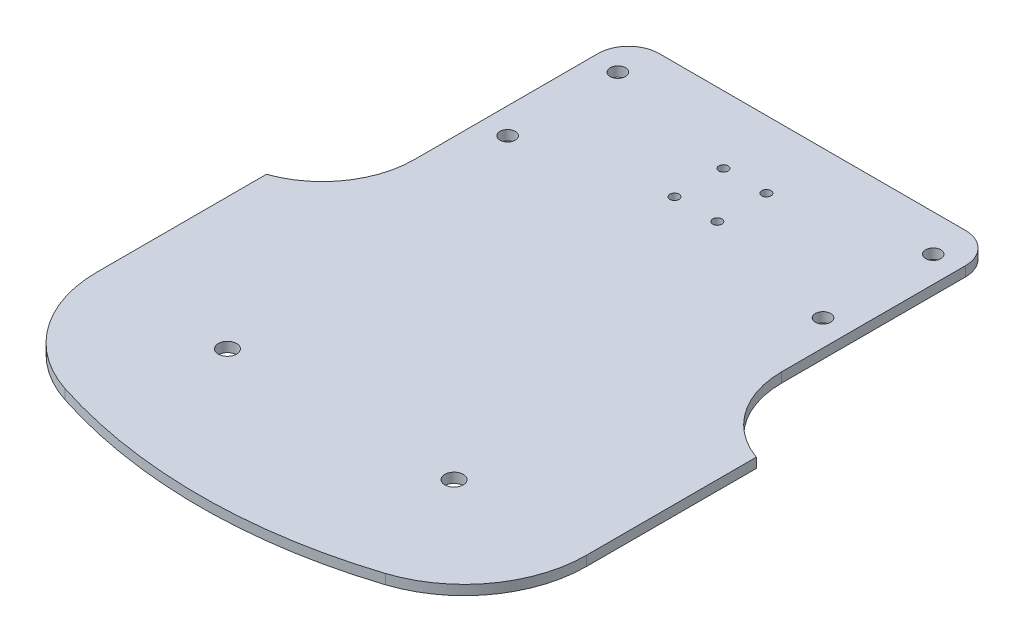
from build123d import *

# Parameters (mm, degrees)
P_IDAT_VYSUNUT_M1_DEPTH  = 0.8
SKICA2_R                 = 1.25
ODEBRAT_VYSUNUT_M1_DEPTH = 94.955095657
SKICA3_R                 = 0.75
ODEBRAT_VYSUNUT_M2_DEPTH = 94.955095657
SKICA8_R                 = 1.5
ODEBRAT_VYSUNUT_M4_DEPTH = 94.955095657


with BuildPart() as part:
    # Skica1 → Přidat vysunutím1 (new, symmetric)
    with BuildSketch(Plane(origin=(0, 0, 0), x_dir=(1, 0, 0), z_dir=(0, 1, 0))):
        with BuildLine():
            Line((-25, 15), (25, 15))
            ThreePointArc((25, 15), (28.535533906, 13.535533906), (30, 10))
            Line((30, 10), (30, -20))
            ThreePointArc((30, -20), (32.752551286, -28.660254038), (40, -34.142135624))
            Line((40, -34.142135624), (40, -61.846584384))
            ThreePointArc((40, -61.846584384), (36.172150801, -73.613552493), (26.153846154, -80.876302656))
            ThreePointArc((26.153846154, -80.876302656), (0, -85), (-26.153846154, -80.876302656))
            ThreePointArc((-26.153846154, -80.876302656), (-36.172150801, -73.613552493), (-40, -61.846584384))
            Line((-40, -61.846584384), (-40, -34.142135624))
            ThreePointArc((-40, -34.142135624), (-32.752551286, -28.660254038), (-30, -20))
            Line((-30, -20), (-30, 10))
            ThreePointArc((-30, 10), (-28.535533906, 13.535533906), (-25, 15))
        make_face()
    extrude(amount=P_IDAT_VYSUNUT_M1_DEPTH, both=True)

    # Skica2 → Odebrat vysunutím1 (cut, through all)
    with BuildSketch(Plane.XZ.offset(0.8)):
        with Locations((-25.75, -9)):
            Circle(SKICA2_R)
        with Locations((-25.75, 9)):
            Circle(SKICA2_R)
        with Locations((25.75, 9)):
            Circle(SKICA2_R)
        with Locations((25.75, -9)):
            Circle(SKICA2_R)
    extrude(amount=-ODEBRAT_VYSUNUT_M1_DEPTH, mode=Mode.SUBTRACT)

    # Skica3 → Odebrat vysunutím2 (cut, through all)
    with BuildSketch(Plane.XZ.offset(0.8)):
        with Locations((-3.5, 4)):
            Circle(SKICA3_R)
        with Locations((3.5, 4)):
            Circle(SKICA3_R)
        with Locations((-3.5, -4)):
            Circle(SKICA3_R)
        with Locations((3.5, -4)):
            Circle(SKICA3_R)
    extrude(amount=-ODEBRAT_VYSUNUT_M2_DEPTH, mode=Mode.SUBTRACT)

    # Skica8 → Odebrat vysunutím4 (cut, through all)
    with BuildSketch(Plane.XZ.offset(0.8)):
        with Locations((18.5, 62)):
            Circle(SKICA8_R)
        with Locations((-18.5, 62)):
            Circle(SKICA8_R)
    extrude(amount=-ODEBRAT_VYSUNUT_M4_DEPTH, mode=Mode.SUBTRACT)


solid = part.part
